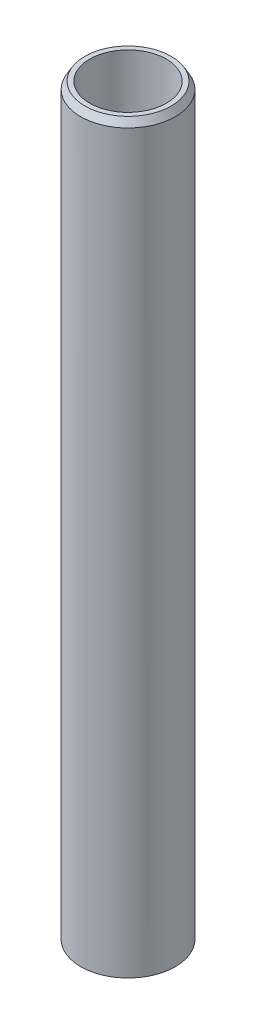
from build123d import *
from OCP.BRepFilletAPI import BRepFilletAPI_MakeChamfer

# Parameters (mm, degrees)
SKETCH1_R           = 25
BOSS_EXTRUDE1_DEPTH = 394.906210516
SKETCH2_R           = 20.239892666
CUT_EXTRUDE1_DEPTH  = 397.485706053
CHAMFER1_SIZE       = 3.772145716
CHAMFER1_SIZE2      = 2.21889069


with BuildPart() as part:
    # Sketch1 → Boss-Extrude1 (new body)
    with BuildSketch(Plane(origin=(0, 0, 0), x_dir=(1, 0, 0), z_dir=(0, 1, 0))):
        Circle(SKETCH1_R)
    extrude(amount=BOSS_EXTRUDE1_DEPTH)

    # Sketch2 → Cut-Extrude1 (cut, through all)
    with BuildSketch(Plane(origin=(0, 0, 0), x_dir=(1, 0, 0), z_dir=(0, 1, 0))):
        Circle(SKETCH2_R)
    extrude(amount=CUT_EXTRUDE1_DEPTH, mode=Mode.SUBTRACT)

    # Chamfer1: one chamfer whose edges measure the first distance from different faces: ONE call of the kernel's chamfer builder (chamfer() names one face for all edges)
    chamfer1_edges_1 = [part.edges().sort_by_distance(p)[0] for p in [
        (-25, 394.906210516, 0),
    ]]
    chamfer1_side_1 = [part.faces().sort_by_distance(p)[0] for p in [
        (-25, 197.453105258, 0),
    ]]
    chamfer1_edges_2 = [part.edges().sort_by_distance(p)[0] for p in [
        (-25, 0, 0),
    ]]
    chamfer1_side_2 = [part.faces().sort_by_distance(p)[0] for p in [
        (-24.292893219, 0, 0),
    ]]
    chamfer1 = BRepFilletAPI_MakeChamfer(part.part.solid().wrapped)
    for e in chamfer1_edges_1:
        chamfer1.Add(CHAMFER1_SIZE, CHAMFER1_SIZE2, e.wrapped, chamfer1_side_1[0].wrapped)  # the first distance lies on this face
    for e in chamfer1_edges_2:
        chamfer1.Add(CHAMFER1_SIZE, CHAMFER1_SIZE2, e.wrapped, chamfer1_side_2[0].wrapped)  # the first distance lies on this face
    add(Compound.cast(chamfer1.Shape()), mode=Mode.REPLACE)


solid = part.part
